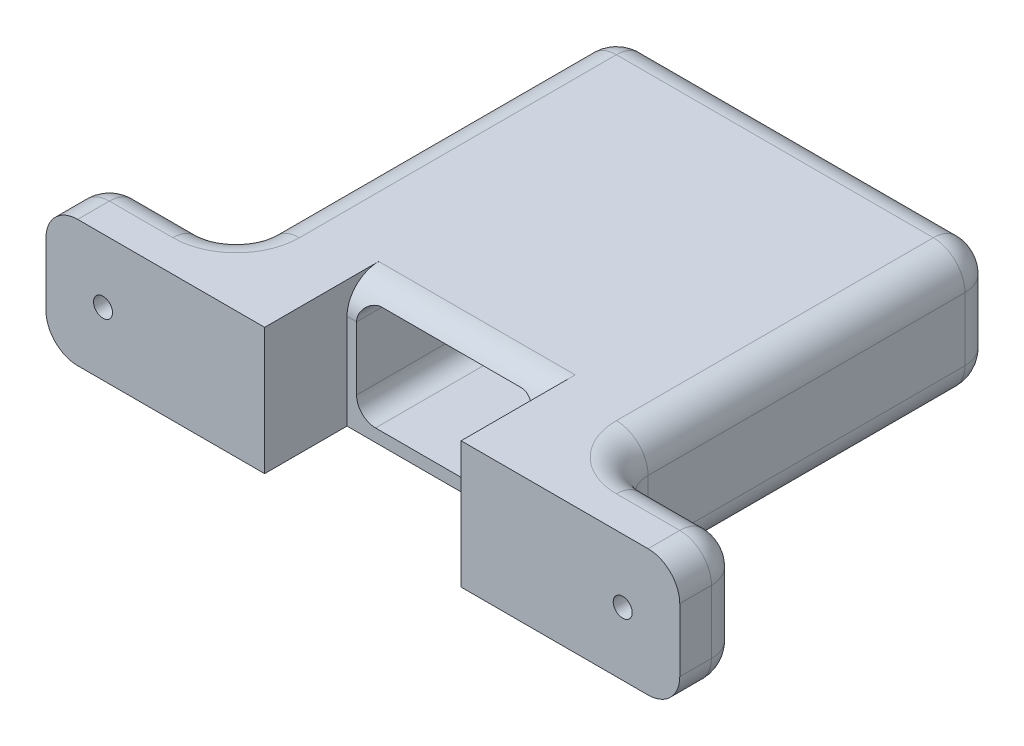
from build123d import *

# Parameters (mm, degrees)
ESBO_O1_W                = 60
ESBO_O1_H                = 20
RESSALTO_EXTRUS_O1_DEPTH = 70
ESBO_O4_W                = 31
ESBO_O4_H                = 13
CORTE_EXTRUS_O2_DEPTH    = 119.003086654
ESBO_O6_W                = 10
ESBO_O6_H                = 20
RESSALTO_EXTRUS_O2_DEPTH = 20
ESBO_O5_W                = 10
ESBO_O5_H                = 20
RESSALTO_EXTRUS_O3_DEPTH = 20
CORTE_EXTRUS_O4_REACH    = 137.752
FILETE1_R                = 5
ESBO_O8_R                = 1.5
CORTE_EXTRUS_O5_DEPTH    = 131.875812627
FILETE2_R                = 5


with BuildPart() as part:
    # Esboço1 → Ressalto-extrusão1 (new body)
    with BuildSketch(Plane.XY):
        with Locations((-62.86941617, -18.088666872)):
            Rectangle(ESBO_O1_W, ESBO_O1_H)
    extrude(amount=RESSALTO_EXTRUS_O1_DEPTH)

    # Esboço4 → Corte-extrusão2 (cut, through all)
    with BuildSketch(Plane(origin=(0, -28.088666872, 0), x_dir=(-1, 0, 0), z_dir=(0, -1, 0))):
        with Locations((62.86941617, -63.5)):
            Rectangle(ESBO_O4_W, ESBO_O4_H)
    extrude(amount=-CORTE_EXTRUS_O2_DEPTH, mode=Mode.SUBTRACT)

    # Esboço6 → Ressalto-extrusão2 (add)
    with BuildSketch(Plane.ZY.offset(92.86941617)):
        with Locations((65, -18.088666872)):
            Rectangle(ESBO_O6_W, ESBO_O6_H)
    extrude(amount=RESSALTO_EXTRUS_O2_DEPTH)

    # Esboço5 → Ressalto-extrusão3 (add)
    with BuildSketch(Plane(origin=(-32.86941617, 0, 0), x_dir=(0, 0, -1), z_dir=(1, 0, 0))):
        with Locations((-65, -18.088666872)):
            Rectangle(ESBO_O5_W, ESBO_O5_H)
    extrude(amount=RESSALTO_EXTRUS_O3_DEPTH)

    # Esboço7 → Corte-extrusão4 (cut, up to next)
    with BuildSketch(Plane(origin=(0, 0, 0), x_dir=(-1, 0, 0), z_dir=(0, 0, -1)), mode=Mode.PRIVATE) as corte_extrus_o4_sk1:
        with BuildLine():
            Line((73.86941617, -26.088666872), (51.86941617, -26.088666872))
            ThreePointArc((51.86941617, -26.088666872), (49.748095827, -25.209987216), (48.86941617, -23.088666872))
            Line((48.86941617, -23.088666872), (48.86941617, -13.088666872))
            ThreePointArc((48.86941617, -13.088666872), (49.748095827, -10.967346529), (51.86941617, -10.088666872))
            Line((51.86941617, -10.088666872), (73.86941617, -10.088666872))
            ThreePointArc((73.86941617, -10.088666872), (75.990736514, -10.967346529), (76.86941617, -13.088666872))
            Line((76.86941617, -13.088666872), (76.86941617, -23.088666872))
            ThreePointArc((76.86941617, -23.088666872), (75.990736514, -25.209987216), (73.86941617, -26.088666872))
        make_face()
    corte_extrus_o4_tool1 = extrude(corte_extrus_o4_sk1.sketch, amount=-CORTE_EXTRUS_O4_REACH, mode=Mode.PRIVATE) & part.part
    add(corte_extrus_o4_tool1.solids().sort_by_distance((-62.869416, -18.088667, 0))[0], mode=Mode.SUBTRACT)

    # Filete1
    # the kernel refuses this fillet: 5 mm, written as the material it adds along each edge
    with BuildSketch(Plane(origin=(-92.86941617, -28.088666872, 60), x_dir=(0, 0, -1), z_dir=(0, 1, 0)), Plane(origin=(-32.86941617, -28.088666872, 60), x_dir=(1, 0, 0), z_dir=(0, 1, 0))) as filete1_piece_1:
        with BuildLine():
            CenterArc((FILETE1_R, FILETE1_R), FILETE1_R, 180, 90)
            Line((0, FILETE1_R), (0, 0))
            Line((0, 0), (FILETE1_R, 0))
        make_face()
    extrude(amount=20)
    # the kernel refuses this fillet: 5 mm, written as the material it takes off along each edge
    with BuildSketch(Plane(origin=(-12.86941617, -8.088666872, 47.5), x_dir=(0, -1, 0), z_dir=(0, 0, 1)), Plane(origin=(-112.86941617, -28.088666872, 82.5), x_dir=(1, 0, 0), z_dir=(0, 0, -1))) as filete1_2_piece_1:
        with BuildLine():
            CenterArc((FILETE1_R, -FILETE1_R), FILETE1_R, 90, 90)
            Line((0, -FILETE1_R), (0, 0))
            Line((0, 0), (FILETE1_R, 0))
        make_face()
    extrude(amount=35, mode=Mode.SUBTRACT)
    with BuildSketch(Plane(origin=(-112.86941617, -8.088666872, 47.5), x_dir=(0, -1, 0), z_dir=(0, 0, 1)), Plane(origin=(-12.86941617, -28.088666872, 82.5), x_dir=(-1, 0, 0), z_dir=(0, 0, -1))) as filete1_2_piece_2:
        with BuildLine():
            CenterArc((FILETE1_R, FILETE1_R), FILETE1_R, 180, 90)
            Line((0, FILETE1_R), (0, 0))
            Line((0, 0), (FILETE1_R, 0))
        make_face()
    extrude(amount=35, mode=Mode.SUBTRACT)
    with BuildSketch(Plane(origin=(-112.86941617, -40.588666872, 60), x_dir=(1, 0, 0), z_dir=(0, 1, 0)), Plane(origin=(-12.86941617, -40.588666872, 60), x_dir=(0, 0, 1), z_dir=(0, 1, 0))) as filete1_2_piece_3:
        with BuildLine():
            CenterArc((FILETE1_R, -FILETE1_R), FILETE1_R, 90, 90)
            Line((0, -FILETE1_R), (0, 0))
            Line((0, 0), (FILETE1_R, 0))
        make_face()
    extrude(amount=45, mode=Mode.SUBTRACT)
    with BuildSketch(Plane(origin=(-105.36941617, -28.088666872, 0), x_dir=(0, 0, 1), z_dir=(1, 0, 0))) as filete1_2_piece_4:
        with BuildLine():
            CenterArc((FILETE1_R, -FILETE1_R), FILETE1_R, 90, 90)
            Line((0, -FILETE1_R), (0, 0))
            Line((0, 0), (FILETE1_R, 0))
        make_face()
    extrude(amount=85, mode=Mode.SUBTRACT)
    with BuildSketch(Plane(origin=(-92.86941617, 4.411333128, 0), x_dir=(1, 0, 0), z_dir=(0, -1, 0)), Plane(origin=(-32.86941617, -40.588666872, 0), x_dir=(-1, 0, 0), z_dir=(0, 1, 0))) as filete1_2_piece_5:
        with BuildLine():
            CenterArc((FILETE1_R, FILETE1_R), FILETE1_R, 180, 90)
            Line((0, FILETE1_R), (0, 0))
            Line((0, 0), (FILETE1_R, 0))
        make_face()
    extrude(amount=45, mode=Mode.SUBTRACT)
    with BuildSketch(Plane(origin=(-20.36941617, -8.088666872, 0), x_dir=(0, -1, 0), z_dir=(-1, 0, 0))) as filete1_2_piece_6:
        with BuildLine():
            CenterArc((FILETE1_R, FILETE1_R), FILETE1_R, 180, 90)
            Line((0, FILETE1_R), (0, 0))
            Line((0, 0), (FILETE1_R, 0))
        make_face()
    extrude(amount=85, mode=Mode.SUBTRACT)
    # the kernel refuses this fillet: 5 mm, written as the material it takes off along each edge
    with BuildSketch(Plane(origin=(-87.86941617, -23.088666872, 5), x_dir=(-1, 0, 0), z_dir=(0, -1, 0))) as filete1_3_piece_1_section:
        Polygon((0, 0), (FILETE1_R, 0), (FILETE1_R, FILETE1_R), (0, FILETE1_R), align=None)
    filete1_3_piece_1 = extrude(amount=FILETE1_R, mode=Mode.PRIVATE)
    filete1_3_piece_1 = filete1_3_piece_1 - Plane(origin=(-87.86941617, -23.088666872, 5), x_dir=(0.7071067811865475, 0, 0.7071067811865475), z_dir=(0, -1, 0)) * Sphere(FILETE1_R, mode=Mode.PRIVATE)
    add(filete1_3_piece_1, mode=Mode.SUBTRACT)
    with BuildSketch(Plane(origin=(-87.86941617, -13.088666872, 5), x_dir=(0, 1, 0), z_dir=(-1, 0, 0))) as filete1_3_piece_2_section:
        Polygon((0, 0), (FILETE1_R, 0), (FILETE1_R, FILETE1_R), (0, FILETE1_R), align=None)
    filete1_3_piece_2 = extrude(amount=FILETE1_R, mode=Mode.PRIVATE)
    filete1_3_piece_2 = filete1_3_piece_2 - Plane(origin=(-87.86941617, -13.088666872, 5), x_dir=(0, -0.7071067811865475, 0.7071067811865475), z_dir=(-1, 0, 0)) * Sphere(FILETE1_R, mode=Mode.PRIVATE)
    add(filete1_3_piece_2, mode=Mode.SUBTRACT)
    with BuildSketch(Plane(origin=(-37.86941617, -13.088666872, 5), x_dir=(0, 1, 0), z_dir=(1, 0, 0))) as filete1_3_piece_3_section:
        Polygon((0, 0), (FILETE1_R, 0), (FILETE1_R, -FILETE1_R), (0, -FILETE1_R), align=None)
    filete1_3_piece_3 = extrude(amount=FILETE1_R, mode=Mode.PRIVATE)
    filete1_3_piece_3 = filete1_3_piece_3 - Plane(origin=(-37.86941617, -13.088666872, 5), x_dir=(0, -0.7071067811865475, 0.7071067811865475), z_dir=(1, 0, 0)) * Sphere(FILETE1_R, mode=Mode.PRIVATE)
    add(filete1_3_piece_3, mode=Mode.SUBTRACT)
    with BuildSketch(Plane(origin=(-37.86941617, -23.088666872, 5), x_dir=(1, 0, 0), z_dir=(0, -1, 0))) as filete1_3_piece_4_section:
        Polygon((0, 0), (FILETE1_R, 0), (FILETE1_R, -FILETE1_R), (0, -FILETE1_R), align=None)
    filete1_3_piece_4 = extrude(amount=FILETE1_R, mode=Mode.PRIVATE)
    filete1_3_piece_4 = filete1_3_piece_4 - Plane(origin=(-37.86941617, -23.088666872, 5), x_dir=(-0.7071067811865475, 0, 0.7071067811865475), z_dir=(0, -1, 0)) * Sphere(FILETE1_R, mode=Mode.PRIVATE)
    add(filete1_3_piece_4, mode=Mode.SUBTRACT)
    with BuildSketch(Plane(origin=(-107.86941617, -23.088666872, 65), x_dir=(0, 0, -1), z_dir=(0, -1, 0))) as filete1_3_piece_5_section:
        Polygon((0, 0), (FILETE1_R, 0), (FILETE1_R, -FILETE1_R), (0, -FILETE1_R), align=None)
    filete1_3_piece_5 = extrude(amount=FILETE1_R, mode=Mode.PRIVATE)
    filete1_3_piece_5 = filete1_3_piece_5 - Plane(origin=(-107.86941617, -23.088666872, 65), x_dir=(0.7071067811865475, 0, 0.7071067811865475), z_dir=(0, -1, 0)) * Sphere(FILETE1_R, mode=Mode.PRIVATE)
    add(filete1_3_piece_5, mode=Mode.SUBTRACT)
    with BuildSketch(Plane(origin=(-17.86941617, -13.088666872, 65), x_dir=(0, 1, 0), z_dir=(0, 0, -1))) as filete1_3_piece_6_section:
        Polygon((0, 0), (FILETE1_R, 0), (FILETE1_R, FILETE1_R), (0, FILETE1_R), align=None)
    filete1_3_piece_6 = extrude(amount=FILETE1_R, mode=Mode.PRIVATE)
    filete1_3_piece_6 = filete1_3_piece_6 - Plane(origin=(-17.86941617, -13.088666872, 65), x_dir=(-0.7071067811865475, -0.7071067811865475, 0), z_dir=(0, 0, -1)) * Sphere(FILETE1_R, mode=Mode.PRIVATE)
    add(filete1_3_piece_6, mode=Mode.SUBTRACT)
    with BuildSketch(Plane(origin=(-17.86941617, -23.088666872, 65), x_dir=(0, 0, -1), z_dir=(0, -1, 0))) as filete1_3_piece_7_section:
        Polygon((0, 0), (FILETE1_R, 0), (FILETE1_R, FILETE1_R), (0, FILETE1_R), align=None)
    filete1_3_piece_7 = extrude(amount=FILETE1_R, mode=Mode.PRIVATE)
    filete1_3_piece_7 = filete1_3_piece_7 - Plane(origin=(-17.86941617, -23.088666872, 65), x_dir=(-0.7071067811865475, 0, 0.7071067811865475), z_dir=(0, -1, 0)) * Sphere(FILETE1_R, mode=Mode.PRIVATE)
    add(filete1_3_piece_7, mode=Mode.SUBTRACT)
    with BuildSketch(Plane(origin=(-107.86941617, -13.088666872, 65), x_dir=(0, 1, 0), z_dir=(0, 0, -1))) as filete1_3_piece_8_section:
        Polygon((0, 0), (FILETE1_R, 0), (FILETE1_R, -FILETE1_R), (0, -FILETE1_R), align=None)
    filete1_3_piece_8 = extrude(amount=FILETE1_R, mode=Mode.PRIVATE)
    filete1_3_piece_8 = filete1_3_piece_8 - Plane(origin=(-107.86941617, -13.088666872, 65), x_dir=(0.7071067811865475, -0.7071067811865475, 0), z_dir=(0, 0, -1)) * Sphere(FILETE1_R, mode=Mode.PRIVATE)
    add(filete1_3_piece_8, mode=Mode.SUBTRACT)
    with BuildSketch(Plane(origin=(-97.86941617, -8.088666872, 60), x_dir=(0, -1, 0), z_dir=(-1, 0, 0)), Plane(origin=(-97.86941617, -28.088666872, 60), x_dir=(0, 0, 1), z_dir=(-1, 0, 0))) as filete1_3_piece_9:
        with BuildLine():
            CenterArc((FILETE1_R, FILETE1_R), FILETE1_R, 180, 90)
            Line((0, FILETE1_R), (0, 0))
            Line((0, 0), (FILETE1_R, 0))
        make_face()
    extrude(amount=10, mode=Mode.SUBTRACT)
    with BuildSketch(Plane(origin=(-27.86941617, -28.088666872, 60), x_dir=(0, 0, 1), z_dir=(1, 0, 0)), Plane(origin=(-27.86941617, -8.088666872, 60), x_dir=(0, -1, 0), z_dir=(1, 0, 0))) as filete1_3_piece_10:
        with BuildLine():
            CenterArc((FILETE1_R, -FILETE1_R), FILETE1_R, 90, 90)
            Line((0, -FILETE1_R), (0, 0))
            Line((0, 0), (FILETE1_R, 0))
        make_face()
    extrude(amount=10, mode=Mode.SUBTRACT)
    with BuildSketch(Plane(origin=(-32.86941617, -28.088666872, 5), x_dir=(-1, 0, 0), z_dir=(0, 0, 1)), Plane(origin=(-32.86941617, -8.088666872, 5), x_dir=(0, -1, 0), z_dir=(0, 0, 1))) as filete1_3_piece_11:
        with BuildLine():
            CenterArc((FILETE1_R, -FILETE1_R), FILETE1_R, 90, 90)
            Line((0, -FILETE1_R), (0, 0))
            Line((0, 0), (FILETE1_R, 0))
        make_face()
    extrude(amount=50, mode=Mode.SUBTRACT)
    with BuildSketch(Plane(origin=(-92.86941617, -8.088666872, 5), x_dir=(0, -1, 0), z_dir=(0, 0, 1)), Plane(origin=(-92.86941617, -28.088666872, 5), x_dir=(1, 0, 0), z_dir=(0, 0, 1))) as filete1_3_piece_12:
        with BuildLine():
            CenterArc((FILETE1_R, FILETE1_R), FILETE1_R, 180, 90)
            Line((0, FILETE1_R), (0, 0))
            Line((0, 0), (FILETE1_R, 0))
        make_face()
    extrude(amount=50, mode=Mode.SUBTRACT)
    with BuildSketch(Plane(origin=(-97.86941617, -28.088666872, 55), x_dir=(1, 0, 0), z_dir=(0, 0, -1))) as filete1_3_piece_13:
        with BuildLine():
            CenterArc((5 + FILETE1_R, -FILETE1_R), FILETE1_R, 90, 90)
            Line((5, -FILETE1_R), (5, 0))
            Line((5, 0), (5 + FILETE1_R, 0))
        make_face()
    revolve(axis=Axis((-97.86941617, -28.088666872, 55), (0, -1, 0)), revolution_arc=90, mode=Mode.SUBTRACT)
    with BuildSketch(Plane(origin=(-97.86941617, -8.088666872, 55), x_dir=(1, 0, 0), z_dir=(0, 0, -1))) as filete1_3_piece_14:
        with BuildLine():
            CenterArc((5 + FILETE1_R, FILETE1_R), FILETE1_R, 180, 90)
            Line((5 + FILETE1_R, 0), (5, 0))
            Line((5, 0), (5, FILETE1_R))
        make_face()
    revolve(axis=Axis((-97.86941617, -8.088666872, 55), (0, -1, 0)), revolution_arc=90, mode=Mode.SUBTRACT)
    with BuildSketch(Plane(origin=(-27.86941617, -8.088666872, 55), x_dir=(0, 0, 1), z_dir=(1, 0, 0))) as filete1_3_piece_15:
        with BuildLine():
            CenterArc((5 + FILETE1_R, FILETE1_R), FILETE1_R, 180, 90)
            Line((5 + FILETE1_R, 0), (5, 0))
            Line((5, 0), (5, FILETE1_R))
        make_face()
    revolve(axis=Axis((-27.86941617, -8.088666872, 55), (0, -1, 0)), revolution_arc=90, mode=Mode.SUBTRACT)
    with BuildSketch(Plane(origin=(-27.86941617, -28.088666872, 55), x_dir=(0, 0, 1), z_dir=(1, 0, 0))) as filete1_3_piece_16:
        with BuildLine():
            CenterArc((5 + FILETE1_R, -FILETE1_R), FILETE1_R, 90, 90)
            Line((5, -FILETE1_R), (5, 0))
            Line((5, 0), (5 + FILETE1_R, 0))
        make_face()
    revolve(axis=Axis((-27.86941617, -28.088666872, 55), (0, -1, 0)), revolution_arc=90, mode=Mode.SUBTRACT)

    # Esboço8 → Corte-extrusão5 (cut, through all)
    with BuildSketch(Plane(origin=(0, 0, 60), x_dir=(-1, 0, 0), z_dir=(0, 0, -1))):
        with Locations((21.86941617, -18.088666872)):
            Circle(ESBO_O8_R)
        with Locations((103.86941617, -18.088666872)):
            Circle(ESBO_O8_R)
    extrude(amount=-CORTE_EXTRUS_O5_DEPTH, mode=Mode.SUBTRACT)

    # Filete2
    # the kernel refuses this fillet: 5 mm, written as the material it takes off along each edge
    with BuildSketch(Plane(origin=(-78.36941617, -8.088666872, 57), x_dir=(0, 0, -1), z_dir=(1, 0, 0))) as filete2_piece_1:
        with BuildLine():
            CenterArc((FILETE2_R, -FILETE2_R), FILETE2_R, 90, 90)
            Line((0, -FILETE2_R), (0, 0))
            Line((0, 0), (FILETE2_R, 0))
        make_face()
    extrude(amount=31, mode=Mode.SUBTRACT)


solid = part.part
